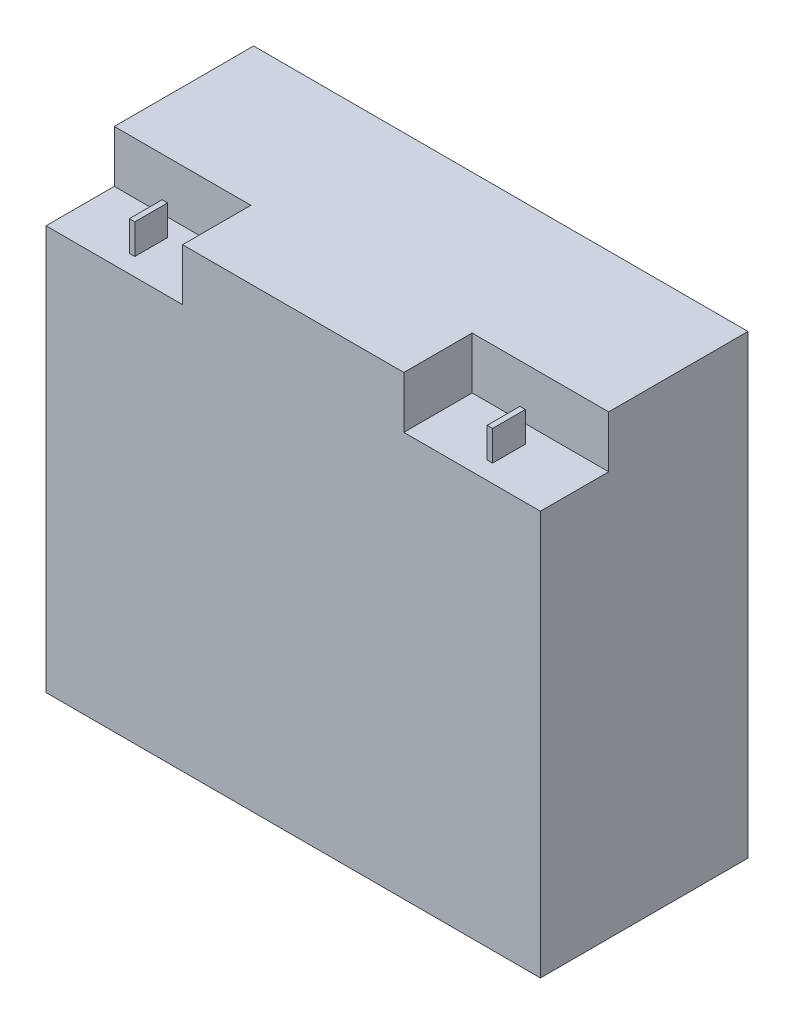
from build123d import *

# Parameters (mm, degrees)
SKETCH1_W           = 181
SKETCH1_H           = 167
BOSS_EXTRUDE1_DEPTH = 38
SKETCH3_W           = 50
SKETCH3_H           = 19
CUT_EXTRUDE1_DEPTH  = 25
SKETCH4_W           = 2
SKETCH4_H           = 12
BOSS_EXTRUDE2_DEPTH = 11


with BuildPart() as part:
    # Sketch1 → Boss-Extrude1 (new, symmetric)
    with BuildSketch(Plane.XY):
        Rectangle(SKETCH1_W, SKETCH1_H)
    extrude(amount=BOSS_EXTRUDE1_DEPTH, both=True)

    # Sketch3 → Cut-Extrude1 (cut)
    with BuildSketch(Plane.XY.offset(38)):
        with Locations((-65.5, 74)):
            Rectangle(SKETCH3_W, SKETCH3_H)
        with Locations((65.5, 74)):
            Rectangle(SKETCH3_W, SKETCH3_H)
    extrude(amount=-CUT_EXTRUDE1_DEPTH, mode=Mode.SUBTRACT)

    # Sketch4 → Boss-Extrude2 (add)
    with BuildSketch(Plane(origin=(0, 64.5, 0), x_dir=(1, 0, 0), z_dir=(0, 1, 0))):
        with Locations((-65.5, -25.5)):
            Rectangle(SKETCH4_W, SKETCH4_H)
        with Locations((65.5, -25.5)):
            Rectangle(SKETCH4_W, SKETCH4_H)
    extrude(amount=BOSS_EXTRUDE2_DEPTH)


solid = part.part
